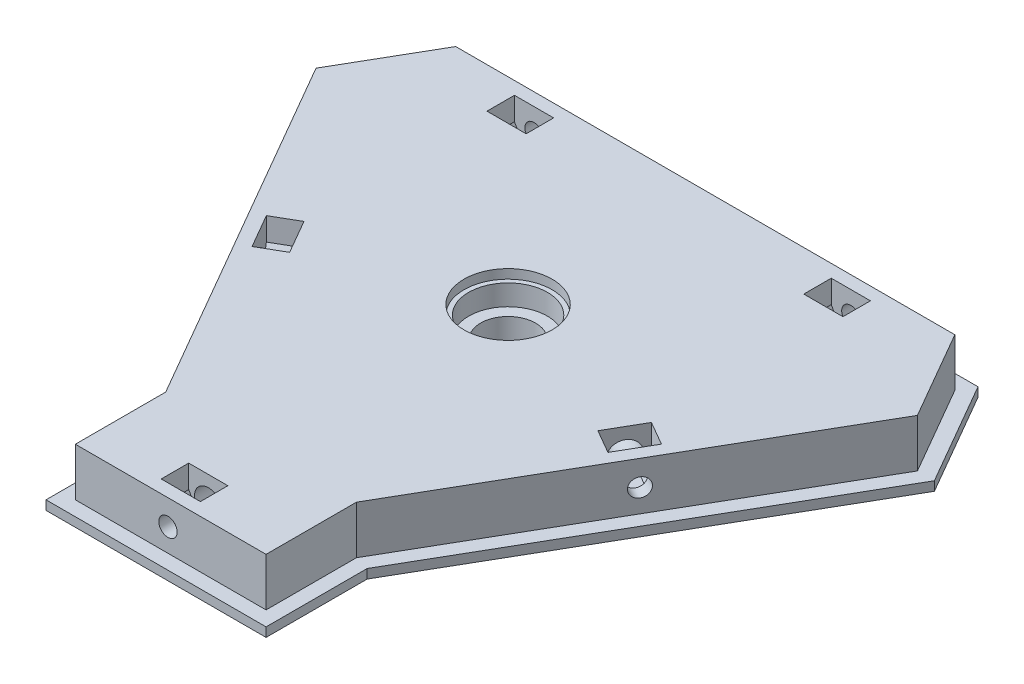
from build123d import *

# Parameters (mm, degrees)
BOSS_EXTRUDE1_DEPTH = 2
BOSS_EXTRUDE2_DEPTH = 10.5
SKETCH5_R           = 6
CUT_EXTRUDE2_DEPTH  = 12.5
SKETCH6_R           = 8.6
CUT_EXTRUDE3_DEPTH  = 6.5
SKETCH7_R           = 9.6
CUT_EXTRUDE4_DEPTH  = 2
SKETCH12_R          = 2
CUT_EXTRUDE16_DEPTH = 20
CUT_EXTRUDE17_START = -2.8
SKETCH10_R          = 2
CUT_EXTRUDE17_DEPTH = 6
CUT_EXTRUDE19_START = -2.8
SKETCH13_R          = 3
CUT_EXTRUDE19_DEPTH = 18
CUT_EXTRUDE23_START = -2.8
CUT_EXTRUDE23_DEPTH = 6
SKETCH15_R          = 2
CUT_EXTRUDE24_DEPTH = 20
CUT_EXTRUDE26_START = -2.8
SKETCH16_R          = 3
CUT_EXTRUDE26_DEPTH = 18
CUT_EXTRUDE28_START = -2.8
CUT_EXTRUDE28_DEPTH = 6
SKETCH18_R          = 2
CUT_EXTRUDE29_DEPTH = 20
CUT_EXTRUDE31_START = -2.8
SKETCH19_R          = 3
CUT_EXTRUDE31_DEPTH = 18
CUT_EXTRUDE32_START = -2.8
CUT_EXTRUDE32_DEPTH = 6
SKETCH21_R          = 2
CUT_EXTRUDE33_DEPTH = 20
CUT_EXTRUDE34_START = -2.8
SKETCH22_R          = 3
CUT_EXTRUDE34_DEPTH = 18


with BuildPart() as part:
    # Sketch1 → Boss-Extrude1 (new body)
    with BuildSketch(Plane(origin=(0, 0, 0), x_dir=(1, 0, 0), z_dir=(0, 1, 0))):
        Polygon((32.282, -123.000385167), (80.282, -123.000385167), (80.282, -100.947385167), (125.564, -22.516660498), (112.564, 0), (0, 0), (-13, -22.516660498), (32.282, -100.947385167), align=None)
    extrude(amount=BOSS_EXTRUDE1_DEPTH)

    # Sketch3 → Boss-Extrude2 (add)
    with BuildSketch(Plane(origin=(0, 2, 0), x_dir=(1, 0, 0), z_dir=(0, 1, 0))):
        Polygon((1.847520861, -3.2), (-9.304958277, -22.516660498), (35.482, -100.089947751), (35.482, -119.800385167), (77.082, -119.800385167), (77.082, -100.089947751), (121.868958277, -22.516660498), (110.716479139, -3.2), align=None)
    extrude(amount=BOSS_EXTRUDE2_DEPTH)

    # Sketch5 → Cut-Extrude2 (cut)
    with BuildSketch(Plane(origin=(0, 12.5, 0), x_dir=(1, 0, 0), z_dir=(0, 1, 0))):
        with Locations((56.282, -46.21633591)):
            Circle(SKETCH5_R)
    extrude(amount=-CUT_EXTRUDE2_DEPTH, mode=Mode.SUBTRACT)

    # Sketch6 → Cut-Extrude3 (cut)
    with BuildSketch(Plane(origin=(0, 12.5, 0), x_dir=(1, 0, 0), z_dir=(0, 1, 0))):
        with Locations((56.282, -46.21633591)):
            Circle(SKETCH6_R)
    extrude(amount=-CUT_EXTRUDE3_DEPTH, mode=Mode.SUBTRACT)

    # Sketch7 → Cut-Extrude4 (cut)
    with BuildSketch(Plane(origin=(0, 12.5, 0), x_dir=(1, 0, 0), z_dir=(0, 1, 0))):
        with Locations((56.282, -46.21633591)):
            Circle(SKETCH7_R)
    extrude(amount=-CUT_EXTRUDE4_DEPTH, mode=Mode.SUBTRACT)

    # Sketch12 → Cut-Extrude16 (cut)
    with BuildSketch(Plane(origin=(0, 0, 3.2), x_dir=(-1, 0, 0), z_dir=(0, 0, -1))):
        with Locations((-21.732020861, 7.5)):
            Circle(SKETCH12_R)
        with Locations((-90.832020861, 7.5)):
            Circle(SKETCH12_R)
    extrude(amount=-CUT_EXTRUDE16_DEPTH, mode=Mode.SUBTRACT)

    # Sketch10 → Cut-Extrude17 (cut)
    # profile 1 of 2: a face of its own
    with BuildSketch(Plane(origin=(0, 0, 3.2), x_dir=(-1, 0, 0), z_dir=(0, 0, -1)).offset(CUT_EXTRUDE17_START)):
        Polygon((-17.459520861, 12.5), (-17.459520861, 7.5), (-19.595770861, 3.799906462), (-23.868270861, 3.799906462), (-26.004520861, 7.5), (-26.004520861, 12.5), align=None)
        with Locations((-21.732020861, 7.5)):
            Circle(SKETCH10_R, mode=Mode.SUBTRACT)
    # profile 2 of 2: a face of its own
    with BuildSketch(Plane(origin=(0, 0, 3.2), x_dir=(-1, 0, 0), z_dir=(0, 0, -1)).offset(CUT_EXTRUDE17_START)):
        Polygon((-95.104479139, 12.5), (-95.104479139, 7.5), (-92.968229139, 3.799906462), (-88.695729139, 3.799906462), (-86.559479139, 7.5), (-86.559479139, 12.5), align=None)
        with Locations((-90.831979139, 7.5)):
            Circle(SKETCH10_R, mode=Mode.SUBTRACT)
    extrude(amount=-CUT_EXTRUDE17_DEPTH, mode=Mode.SUBTRACT)

    # Sketch13 → Cut-Extrude19 (cut)
    with BuildSketch(Plane(origin=(0, 0, 3.2), x_dir=(-1, 0, 0), z_dir=(0, 0, -1)).offset(CUT_EXTRUDE19_START)):
        with Locations((-21.732020861, 7.5)):
            Circle(SKETCH13_R)
        with Locations((-90.832020861, 7.5)):
            Circle(SKETCH13_R)
    extrude(amount=-CUT_EXTRUDE19_DEPTH, mode=Mode.SUBTRACT)

    # Sketch14 → Cut-Extrude23 (cut)
    with BuildSketch(Plane.XY.offset(119.800385167).offset(CUT_EXTRUDE23_START)):
        Polygon((59.954, 12.5), (51.41, 12.5), (51.41, 7.5), (53.546, 3.800339475), (57.818, 3.800339475), (59.954, 7.5), align=None)
    extrude(amount=-CUT_EXTRUDE23_DEPTH, mode=Mode.SUBTRACT)

    # Sketch15 → Cut-Extrude24 (cut)
    with BuildSketch(Plane.XY.offset(119.800385167)):
        with Locations((55.682, 7)):
            Circle(SKETCH15_R)
    extrude(amount=-CUT_EXTRUDE24_DEPTH, mode=Mode.SUBTRACT)

    # Sketch16 → Cut-Extrude26 (cut)
    with BuildSketch(Plane.XY.offset(119.800385167).offset(CUT_EXTRUDE26_START)):
        with Locations((55.682, 7)):
            Circle(SKETCH16_R)
    extrude(amount=-CUT_EXTRUDE26_DEPTH, mode=Mode.SUBTRACT)

    # Sketch17 → Cut-Extrude28 (cut)
    with BuildSketch(Plane(origin=(101.151718708, 0, 58.399972025), x_dir=(0.5000000000000001, 0, -0.8660254037844386), z_dir=(0.8660254037844386, 0, 0.5000000000000001)).offset(CUT_EXTRUDE28_START)):
        Polygon((1.314479139, 12.5), (-7.229520861, 12.5), (-7.229520861, 7.5), (-5.093520861, 3.800339475), (-0.821520861, 3.800339475), (1.314479139, 7.5), align=None)
    extrude(amount=-CUT_EXTRUDE28_DEPTH, mode=Mode.SUBTRACT)

    # Sketch18 → Cut-Extrude29 (cut)
    with BuildSketch(Plane(origin=(101.151718708, 0, 58.399972025), x_dir=(0.5000000000000001, 0, -0.8660254037844386), z_dir=(0.8660254037844386, 0, 0.5000000000000001))):
        with Locations((-2.867520861, 7)):
            Circle(SKETCH18_R)
    extrude(amount=-CUT_EXTRUDE29_DEPTH, mode=Mode.SUBTRACT)

    # Sketch19 → Cut-Extrude31 (cut)
    with BuildSketch(Plane(origin=(101.151718708, 0, 58.399972025), x_dir=(0.5000000000000001, 0, -0.8660254037844386), z_dir=(0.8660254037844386, 0, 0.5000000000000001)).offset(CUT_EXTRUDE31_START)):
        with Locations((-2.867520861, 7)):
            Circle(SKETCH19_R)
    extrude(amount=-CUT_EXTRUDE31_DEPTH, mode=Mode.SUBTRACT)

    # Sketch20 → Cut-Extrude32 (cut)
    with BuildSketch(Plane(origin=(-16.728718708, 0, 9.658330249), x_dir=(0.5000000000000001, 0, 0.8660254037844386), z_dir=(-0.8660254037844386, 0, 0.5000000000000001)).offset(CUT_EXTRUDE32_START)):
        Polygon((63.421520861, 12.5), (54.877520861, 12.5), (54.877520861, 7.5), (57.013520861, 3.800339475), (61.285520861, 3.800339475), (63.421520861, 7.5), align=None)
    extrude(amount=-CUT_EXTRUDE32_DEPTH, mode=Mode.SUBTRACT)

    # Sketch21 → Cut-Extrude33 (cut)
    with BuildSketch(Plane(origin=(-16.728718708, 0, 9.658330249), x_dir=(0.5000000000000001, 0, 0.8660254037844386), z_dir=(-0.8660254037844386, 0, 0.5000000000000001))):
        with Locations((59.149520861, 7)):
            Circle(SKETCH21_R)
    extrude(amount=-CUT_EXTRUDE33_DEPTH, mode=Mode.SUBTRACT)

    # Sketch22 → Cut-Extrude34 (cut)
    with BuildSketch(Plane(origin=(-16.728718708, 0, 9.658330249), x_dir=(0.5000000000000001, 0, 0.8660254037844386), z_dir=(-0.8660254037844386, 0, 0.5000000000000001)).offset(CUT_EXTRUDE34_START)):
        with Locations((59.149520861, 7)):
            Circle(SKETCH22_R)
    extrude(amount=-CUT_EXTRUDE34_DEPTH, mode=Mode.SUBTRACT)


solid = part.part
